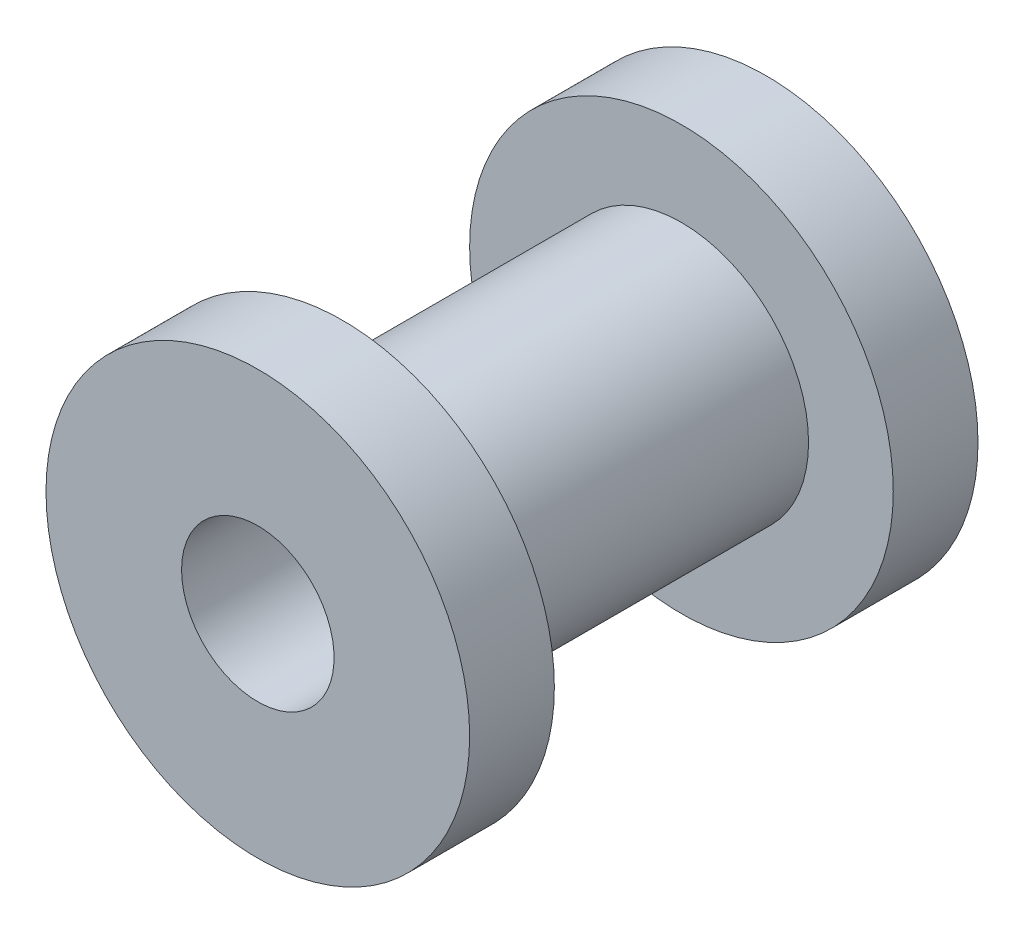
from build123d import *

# Parameters (mm, degrees)
SKETCH1_R           = 9.525
BOSS_EXTRUDE1_DEPTH = 25.4
SKETCH2_R           = 15.875
BOSS_EXTRUDE2_DEPTH = 6.35
BOSS_EXTRUDE3_START = 6.35
SKETCH3_R           = 15.875
BOSS_EXTRUDE3_DEPTH = 6.35
SKETCH4_R           = 5.715
CUT_EXTRUDE1_DEPTH  = 45.22263278


with BuildPart() as part:
    # Sketch1 → Boss-Extrude1 (new body)
    with BuildSketch(Plane.XY):
        Circle(SKETCH1_R)
    extrude(amount=BOSS_EXTRUDE1_DEPTH)

    # Sketch2 → Boss-Extrude2 (add)
    with BuildSketch(Plane.XY.offset(25.4)):
        Circle(SKETCH2_R)
    extrude(amount=BOSS_EXTRUDE2_DEPTH)

    # Sketch3 → Boss-Extrude3 (add)
    with BuildSketch(Plane(origin=(0, 0, 0), x_dir=(-1, 0, 0), z_dir=(0, 0, -1)).offset(BOSS_EXTRUDE3_START)):
        Circle(SKETCH3_R)
    extrude(amount=-BOSS_EXTRUDE3_DEPTH)

    # Sketch4 → Cut-Extrude1 (cut, through all)
    with BuildSketch(Plane(origin=(0, 0, -6.35), x_dir=(-1, 0, 0), z_dir=(0, 0, -1))):
        Circle(SKETCH4_R)
    extrude(amount=-CUT_EXTRUDE1_DEPTH, mode=Mode.SUBTRACT)


solid = part.part
